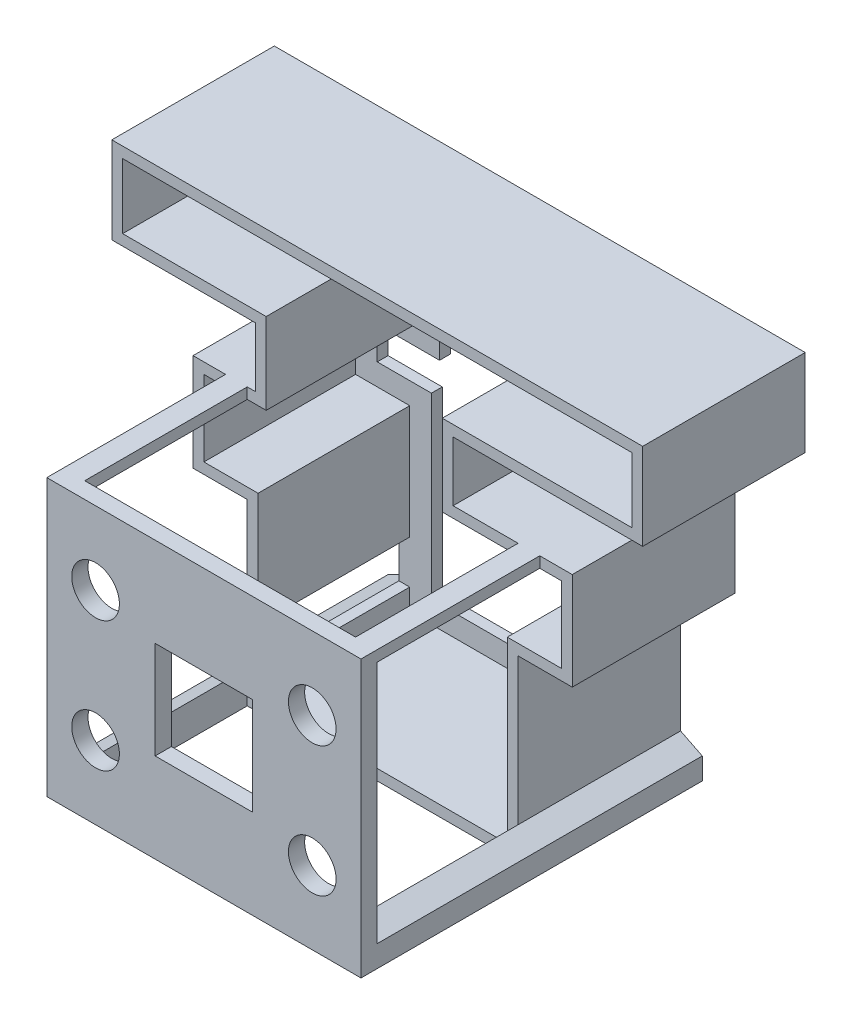
from build123d import *

# Parameters (mm, degrees)
EXTRUDE_1_DEPTH      = 15
CUT_EXTRUDE_1_DEPTH  = 14
SKETCH_7_W           = 47
SKETCH_7_H           = 6
CUT_EXTRUDE_2_DEPTH  = 1
SKETCH_8_W           = 14
SKETCH_8_H           = 4
CUT_EXTRUDE_3_DEPTH  = 1
CUT_EXTRUDE_6_DEPTH  = 1
EXTRUDE_START        = -30
EXTRUDE_10_OUTLINE_W = 2
EXTRUDE_10_OUTLINE_H = 1
EXTRUDE_10_DEPTH     = 30
SKETCH_29_W          = 29
SKETCH_29_H          = 25.5
EXTRUDE_12_DEPTH     = 1.5
SKETCH_30_R          = 2.2
SKETCH_30_W          = 9
SKETCH_30_H          = 9
CUT_EXTRUDE_8_DEPTH  = 1.5


# Read off the part's stored shape, not the designer's step: 凸台-拉伸10
with BuildPart() as part:
    # 草图3 → 凸台-拉伸1 (new body)
    with BuildSketch(Plane.XY):
        Polygon((-25, 21.5), (24, 21.5), (24, 13.5), (6.5, 13.5), (6.5, 8), (17.5, 8), (17.5, -1), (12.5, -1), (12.5, -17.5), (-12.5, -17.5), (-12.5, -1), (-17.5, -1), (-17.5, 8), (-11.75, 8), (-11.75, 13.5), (-25, 13.5), align=None)
    extrude(amount=EXTRUDE_1_DEPTH)

    # 草图4 → 切除-拉伸1 (cut)
    with BuildSketch(Plane.XY.offset(15)):
        Polygon((23, 20.5), (-24, 20.5), (-24, 14.5), (-10.75, 14.5), (-10.75, 7), (-16.5, 7), (-16.5, 0), (-11.5, 0), (-11.5, -16.5), (11.5, -16.5), (11.5, 0), (16.5, 0), (16.5, 7), (5.5, 7), (5.5, 14.5), (23, 14.5), align=None)
    extrude(amount=-CUT_EXTRUDE_1_DEPTH, mode=Mode.SUBTRACT)

    # 草图7 → 切除-拉伸2 (cut)
    with BuildSketch(Plane.XY.offset(1)):
        with Locations((-0.5, 17.5)):
            Rectangle(SKETCH_7_W, SKETCH_7_H)
    extrude(amount=-CUT_EXTRUDE_2_DEPTH, mode=Mode.SUBTRACT)

    # 草图8 → 切除-拉伸3 (cut)
    with BuildSketch(Plane.ZY.offset(12.5)):
        with Locations((8, -12.5)):
            Rectangle(SKETCH_8_W, SKETCH_8_H)
    extrude(amount=-CUT_EXTRUDE_3_DEPTH, mode=Mode.SUBTRACT)

    # 草图9 → 切除-拉伸6 (cut)
    with BuildSketch(Plane(origin=(0, 0, 0), x_dir=(-1, 0, 0), z_dir=(0, 0, -1))):
        Polygon((-3.5, 11.5), (-3.5, 5), (-14.5, 5), (-14.5, 2), (-9.5, 2), (-9.5, -14.5), (9.5, -14.5), (9.5, 2), (14.5, 2), (14.5, 5), (8.75, 5), (8.75, 11.5), align=None)
    extrude(amount=-CUT_EXTRUDE_6_DEPTH, mode=Mode.SUBTRACT)

    # 凸台-拉伸10 outline → 凸台-拉伸10 (add)
    with BuildSketch(Plane(origin=(0, 0, 0), x_dir=(-1, 0, 0), z_dir=(0, 0, -1)).offset(EXTRUDE_START)):
        Polygon((-14.5, -17.5), (-12.5, -17.5), (-12.5, -14.5), (-14.5, -15.5), align=None)
        Polygon((12.5, -17.5), (14.5, -17.5), (14.5, -15.5), (12.5, -14.5), align=None)
        with Locations((-13.5, 7.5)):
            Rectangle(EXTRUDE_10_OUTLINE_W, EXTRUDE_10_OUTLINE_H)
        with Locations((13.5, 7.5)):
            Rectangle(EXTRUDE_10_OUTLINE_W, EXTRUDE_10_OUTLINE_H)
    extrude(amount=EXTRUDE_10_DEPTH)

    # 草图29 → 凸台-拉伸12 (add)
    with BuildSketch(Plane.XY.offset(30)):
        with Locations((0, -4.75)):
            Rectangle(SKETCH_29_W, SKETCH_29_H)
    extrude(amount=EXTRUDE_12_DEPTH)

    # 草图30 → 切除-拉伸8 (cut)
    with BuildSketch(Plane.XY.offset(31.5)):
        with Locations((-10, 1.25)):
            Circle(SKETCH_30_R)
        with Locations((-10, -10.75)):
            Circle(SKETCH_30_R)
        with Locations((10, 1.25)):
            Circle(SKETCH_30_R)
        with Locations((10, -10.75)):
            Circle(SKETCH_30_R)
        with Locations((0, -4.75)):
            Rectangle(SKETCH_30_W, SKETCH_30_H)
    extrude(amount=-CUT_EXTRUDE_8_DEPTH, mode=Mode.SUBTRACT)


solid = part.part
